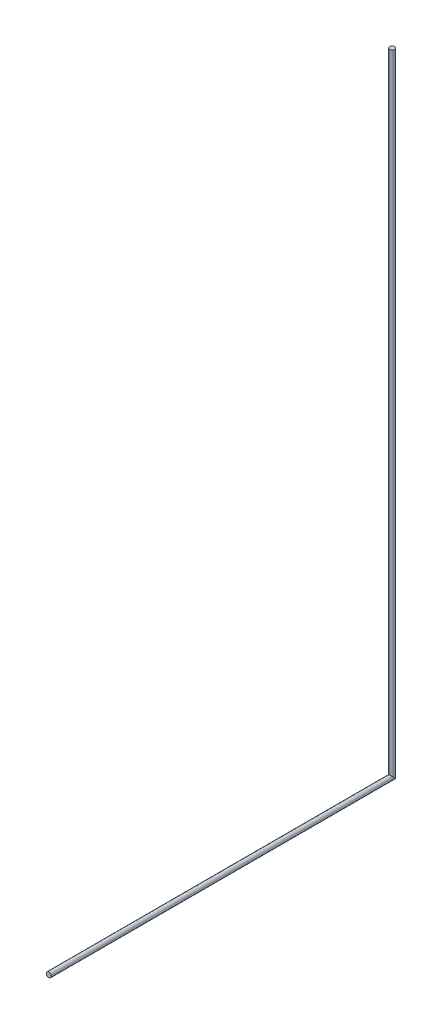
from build123d import *

# Parameters (mm, degrees)
SKETCH_1_R      = 4
EXTRUDE_1_DEPTH = 1015
SKETCH_2_R      = 4
EXTRUDE_2_DEPTH = 552.5
FILLET_1_R      = 13


with BuildPart() as part:
    # Эскиз1 → Бобышка-Вытянуть1 (new body)
    with BuildSketch(Plane(origin=(0, 0, 0), x_dir=(1, 0, 0), z_dir=(0, 1, 0))):
        with Locations(Location((0, 0, 0), (0, 0, 270))):
            Circle(SKETCH_1_R)
    extrude(amount=EXTRUDE_1_DEPTH)

    # Эскиз2 → Бобышка-Вытянуть2 (add)
    with BuildSketch(Plane.XY):
        Circle(SKETCH_2_R)
    extrude(amount=EXTRUDE_2_DEPTH)

    # Скругление1
    # the kernel refuses this fillet: 13 mm, written as the material it adds along each edge
    with BuildSketch(Plane(origin=(-36.5, 0, 0), x_dir=(0, 0, -1), z_dir=(1, 0, 0))) as fillet_1_piece_1_section:
        with BuildLine():
            CenterArc((FILLET_1_R, -FILLET_1_R), FILLET_1_R, 90, 90)
            Line((0, -FILLET_1_R), (0, 0))
            Line((0, 0), (FILLET_1_R, 0))
        make_face()
    fillet_1_piece_1 = extrude(amount=73, mode=Mode.PRIVATE)
    fillet_1_piece_1 = fillet_1_piece_1 & Plane(origin=(0, -1.764763788, 0), x_dir=(0, 0, 1), z_dir=(0, -1, 0)) * Cylinder(4, 198, mode=Mode.PRIVATE)
    fillet_1_piece_1 = fillet_1_piece_1 & Plane(origin=(0, 0, -1.764763788), x_dir=(1, 0, 0), z_dir=(0, 0, -1)) * Cylinder(4, 198, mode=Mode.PRIVATE)
    add(fillet_1_piece_1)


solid = part.part
